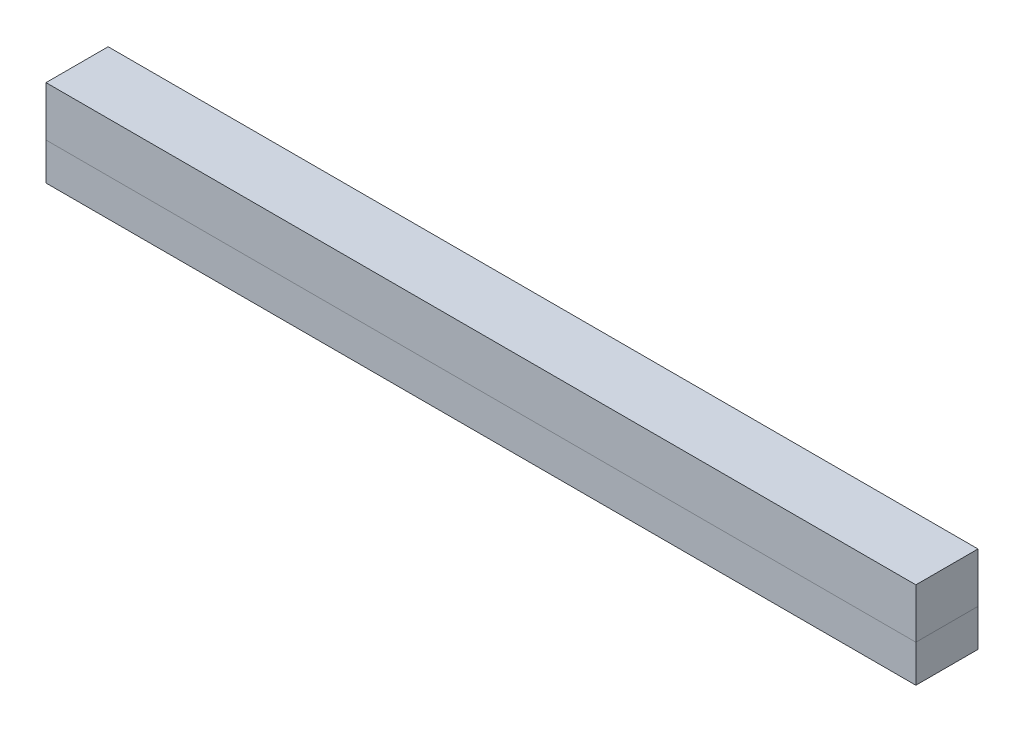
from build123d import *

# Parameters (mm, degrees)
SKETCH1_W           = 14000
SKETCH1_H           = 1000
BOSS_EXTRUDE1_DEPTH = 800
SKETCH2_W           = 14000
SKETCH2_H           = 1000
BOSS_EXTRUDE2_DEPTH = 600


with BuildPart() as part:
    # Sketch1 → Boss-Extrude1 (new body)
    with BuildSketch(Plane(origin=(0, 0, 0), x_dir=(1, 0, 0), z_dir=(0, 1, 0))):
        Rectangle(SKETCH1_W, SKETCH1_H)
    extrude(amount=BOSS_EXTRUDE1_DEPTH)


with BuildPart() as body_2:
    # Sketch2 → Boss-Extrude2 (new body)
    with BuildSketch(Plane(origin=(0, 0, 0), x_dir=(1, 0, 0), z_dir=(0, 1, 0))):
        Rectangle(SKETCH2_W, SKETCH2_H)
    extrude(amount=-BOSS_EXTRUDE2_DEPTH)


solid = Compound([part.part, body_2.part])
